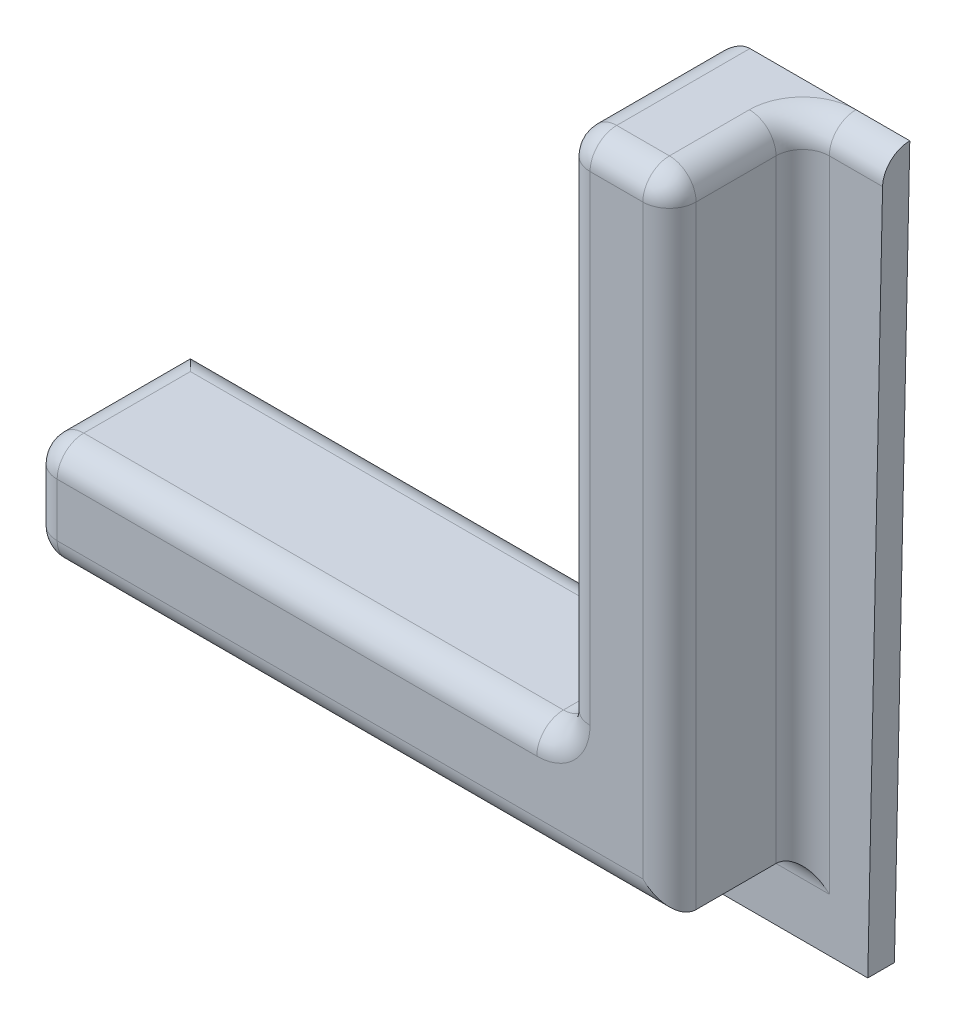
from build123d import *

# Parameters (mm, degrees)
EXTRUDE_1_DEPTH     = 0.3
CUT_EXTRUDE_1_DEPTH = 0.25
FILLET_1_R          = 0.05


with BuildPart() as part:
    # 草图1 → 凸台-拉伸1 (new body)
    with BuildSketch(Plane.XY):
        Polygon((-22.626824825, 6.798687558), (-22.626824825, 6.998687558), (-21.626824825, 6.998687558), (-21.626824825, 7.998687558), (-21.426824825, 7.998687558), (-21.426824825, 6.798687558), align=None)
        Polygon((-21.276824825, 7.998687558), (-21.30567647, 6.648687558), (-22.626824825, 6.648687558), (-22.626824825, 6.798687558), (-21.426824825, 6.798687558), (-21.426824825, 7.998687558), align=None)
    extrude(amount=EXTRUDE_1_DEPTH)

    # 草图2 → 切除-拉伸1 (cut)
    with BuildSketch(Plane.XY.offset(0.3)):
        Polygon((-21.30567647, 6.648687558), (-21.276824825, 7.998687558), (-21.427868997, 7.998687558), (-21.427868997, 6.798687558), (-21.477868997, 6.798687558), (-22.626824825, 6.798687558), (-22.626824825, 6.648687558), align=None)
    extrude(amount=-CUT_EXTRUDE_1_DEPTH, mode=Mode.SUBTRACT)

    # 圆角1
    fillet_1_edges = [part.edges().sort_by_distance(p)[0] for p in [
        (-22.626824825, 6.723687558, 0.05),
        (-21.352346911, 7.998687558, 0.05),
        (-22.626824825, 6.898687558, 0.3),
        (-22.126824825, 6.998687558, 0.3),
        (-21.527346911, 7.998687558, 0.3),
        (-21.427868997, 7.398687558, 0.3),
        (-22.027346911, 6.798687558, 0.3),
        (-21.626824825, 7.998687558, 0.15),
        (-21.626824825, 7.498687558, 0.3),
        (-21.626824825, 6.998687558, 0.15),
        (-21.626824825, 7.498687558, 0),
        (-22.626824825, 6.798687558, 0.175),
        (-22.626824825, 6.998687558, 0.15),
        (-21.427868997, 7.998687558, 0.175),
        (-22.027346911, 6.798687558, 0.05),
        (-22.126824825, 6.998687558, 0),
        (-21.427868997, 7.398687558, 0.05),
    ]]
    fillet(fillet_1_edges, radius=FILLET_1_R - 0.0001)  # a hair under: the kernel refuses the full size


solid = part.part
